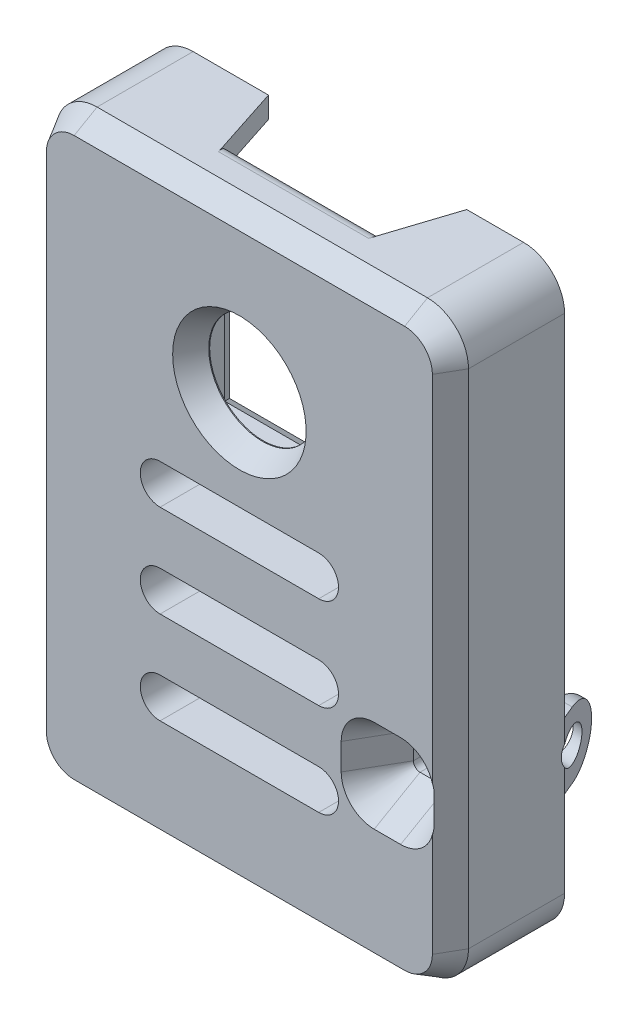
from build123d import *

# Parameters (mm, degrees)
BODY_DEPTH              = 4
SIDEWALLS_DEPTH         = 9
SKETCH2_R               = 4.05
CAMLENS_DEPTH           = 29.509121347
SKETCH3_W               = 8.5
SKETCH3_H               = 8.5
CAMBODY_DEPTH           = 2.2
BOARDSTOPTOP_DEPTH      = 0.4
BOARDSTOPBOTTOM_DEPTH   = 2.2
VENTS_DEPTH             = 28.509452921
FILLET1_START           = -6.2
FILLET1_DEPTH           = 3.2
FILLET1_START_2         = -4.4
FILLET1_2_DEPTH         = 1.4
CHAMFER1_SIZE           = 1
CHAMFER1_SIZE2          = 1.732050808
CHAMFER2_SIZE           = 2
CHAMFER2_SIZE_2         = 3.464101615
CHAMFER3_SIZE           = 0.5
CHAMFER3_SIZE_2         = 0.866025404
CUT_EXTRUDE3_DEPTH      = 47.250621617
FILLET2_R               = 1
ASSYLOCK1_START         = -15.6
ASSYLOCK1_DEPTH         = 1.6
ASSYLOCK2_START         = 14
ASSYLOCK2_DEPTH         = 1.6
CUT_EXTRUDE4_DEPTH      = 30.799664428
CUT_EXTRUDE4_DEPTH_BACK = 30.799664428
SKETCH8_R               = 1.25
CUT_EXTRUDE5_DEPTH      = 30.799664428


with BuildPart() as part:
    # Sketch1 → Body (new body)
    with BuildSketch(Plane.XY):
        with BuildLine():
            Line((-12.5, 20.5), (12.5, 20.5))
            ThreePointArc((12.5, 20.5), (13.560660172, 20.060660172), (14, 19))
            Line((14, 19), (14, -19))
            ThreePointArc((14, -19), (13.560660172, -20.060660172), (12.5, -20.5))
            Line((12.5, -20.5), (-12.5, -20.5))
            ThreePointArc((-12.5, -20.5), (-13.560660172, -20.060660172), (-14, -19))
            Line((-14, -19), (-14, 19))
            ThreePointArc((-14, 19), (-13.560660172, 20.060660172), (-12.5, 20.5))
        make_face()
    extrude(amount=-BODY_DEPTH)

    # Sketch1<2> → SideWalls (add)
    with BuildSketch(Plane.XY):
        with BuildLine():
            Line((12.5, -22.1), (-12.5, -22.1))
            ThreePointArc((-12.5, -22.1), (-14.692031022, -21.192031022), (-15.6, -19))
            Line((-15.6, -19), (-15.6, 19))
            ThreePointArc((-15.6, 19), (-14.692031022, 21.192031022), (-12.5, 22.1))
            Line((-12.5, 22.1), (12.5, 22.1))
            ThreePointArc((12.5, 22.1), (14.692031022, 21.192031022), (15.6, 19))
            Line((15.6, 19), (15.6, -19))
            ThreePointArc((15.6, -19), (14.692031022, -21.192031022), (12.5, -22.1))
        make_face()
        with BuildLine():
            Line((12.5, -20.5), (-12.5, -20.5))
            ThreePointArc((-12.5, -20.5), (-13.560660172, -20.060660172), (-14, -19))
            Line((-14, -19), (-14, 19))
            ThreePointArc((-14, 19), (-13.560660172, 20.060660172), (-12.5, 20.5))
            Line((-12.5, 20.5), (12.5, 20.5))
            ThreePointArc((12.5, 20.5), (13.560660172, 20.060660172), (14, 19))
            Line((14, 19), (14, -19))
            ThreePointArc((14, -19), (13.560660172, -20.060660172), (12.5, -20.5))
        make_face(mode=Mode.SUBTRACT)
    extrude(amount=-SIDEWALLS_DEPTH)

    # Sketch2 → CamLens (cut, through all)
    with BuildSketch(Plane.XY):
        with Locations((0, 10.5)):
            Circle(SKETCH2_R)
        with BuildLine():
            Line((12.2, -8), (10.2, -8))
            ThreePointArc((10.2, -8), (9.846446609, -8.146446609), (9.7, -8.5))
            Line((9.7, -8.5), (9.7, -10.5))
            ThreePointArc((9.7, -10.5), (9.846446609, -10.853553391), (10.2, -11))
            Line((10.2, -11), (12.2, -11))
            ThreePointArc((12.2, -11), (12.553553391, -10.853553391), (12.7, -10.5))
            Line((12.7, -10.5), (12.7, -8.5))
            ThreePointArc((12.7, -8.5), (12.553553391, -8.146446609), (12.2, -8))
        make_face()
    extrude(amount=-CAMLENS_DEPTH, mode=Mode.SUBTRACT)

    # Sketch3 → CamBody (cut)
    with BuildSketch(Plane(origin=(0, 0, -4), x_dir=(-1, 0, 0), z_dir=(0, 0, -1))):
        with Locations((0, 10.5)):
            Rectangle(SKETCH3_W, SKETCH3_H)
    extrude(amount=-CAMBODY_DEPTH, mode=Mode.SUBTRACT)

    # Sketch4 → BoardStopTop (add)
    # profile 1 of 2: a face of its own
    with BuildSketch(Plane(origin=(0, 0, -4), x_dir=(-1, 0, 0), z_dir=(0, 0, -1))):
        with BuildLine():
            Line((-14, 14.75), (-14, 19))
            ThreePointArc((-14, 19), (-13.560660172, 20.060660172), (-12.5, 20.5))
            Line((-12.5, 20.5), (12.5, 20.5))
            ThreePointArc((12.5, 20.5), (13.560660172, 20.060660172), (14, 19))
            Line((14, 19), (14, 14.75))
            Line((14, 14.75), (-14, 14.75))
        make_face()
    # profile 2 of 2: a face of its own
    with BuildSketch(Plane(origin=(0, 0, -4), x_dir=(-1, 0, 0), z_dir=(0, 0, -1))):
        with BuildLine():
            Line((-12.2, -12.3), (-10.2, -12.3))
            ThreePointArc((-10.2, -12.3), (-8.927207794, -11.772792206), (-8.4, -10.5))
            Line((-8.4, -10.5), (-8.4, -8.5))
            ThreePointArc((-8.4, -8.5), (-8.927207794, -7.227207794), (-10.2, -6.7))
            Line((-10.2, -6.7), (-12.2, -6.7))
            ThreePointArc((-12.2, -6.7), (-13.472792206, -7.227207794), (-14, -8.5))
            Line((-14, -8.5), (-14, -10.5))
            ThreePointArc((-14, -10.5), (-13.472792206, -11.772792206), (-12.2, -12.3))
        make_face()
        with BuildLine():
            Line((-12.7, -8.5), (-12.7, -10.5))
            ThreePointArc((-12.7, -10.5), (-12.553553391, -10.853553391), (-12.2, -11))
            Line((-12.2, -11), (-10.2, -11))
            ThreePointArc((-10.2, -11), (-9.846446609, -10.853553391), (-9.7, -10.5))
            Line((-9.7, -10.5), (-9.7, -8.5))
            ThreePointArc((-9.7, -8.5), (-9.846446609, -8.146446609), (-10.2, -8))
            Line((-10.2, -8), (-12.2, -8))
            ThreePointArc((-12.2, -8), (-12.553553391, -8.146446609), (-12.7, -8.5))
        make_face(mode=Mode.SUBTRACT)
    extrude(amount=BOARDSTOPTOP_DEPTH)

    # Sketch5 → BoardStopBottom (add)
    with BuildSketch(Plane(origin=(0, 0, -4), x_dir=(-1, 0, 0), z_dir=(0, 0, -1))):
        with BuildLine():
            Line((12.5, -20.5), (-12.5, -20.5))
            ThreePointArc((-12.5, -20.5), (-13.560660172, -20.060660172), (-14, -19))
            Line((-14, -19), (-14, -16))
            Line((-14, -16), (14, -16))
            Line((14, -16), (14, -19))
            ThreePointArc((14, -19), (13.560660172, -20.060660172), (12.5, -20.5))
        make_face()
    extrude(amount=BOARDSTOPBOTTOM_DEPTH)

    # Sketch10 → Vents (cut, through all)
    with BuildSketch(Plane(origin=(0, 0, -4), x_dir=(-1, 0, 0), z_dir=(0, 0, -1))):
        with BuildLine():
            Line((-6, -4), (6, -4))
            ThreePointArc((6, -4), (7.5, -5.5), (6, -7))
            Line((6, -7), (-6, -7))
            ThreePointArc((-6, -7), (-7.5, -5.5), (-6, -4))
        make_face()
        with BuildLine():
            Line((-6, -11), (6, -11))
            ThreePointArc((6, -11), (7.5, -12.5), (6, -14))
            Line((6, -14), (-6, -14))
            ThreePointArc((-6, -14), (-7.5, -12.5), (-6, -11))
        make_face()
        with BuildLine():
            Line((-6, 3), (6, 3))
            ThreePointArc((6, 3), (7.5, 1.5), (6, 0))
            Line((6, 0), (-6, 0))
            ThreePointArc((-6, 0), (-7.5, 1.5), (-6, 3))
        make_face()
    extrude(amount=-VENTS_DEPTH, mode=Mode.SUBTRACT)

    # Fillet1: read off the stored shape, not the designer's step
    # Fillet1 outline → Fillet1 (add)
    with BuildSketch(Plane.XY.offset(FILLET1_START)):
        with BuildLine():
            Line((-14, -16), (-13, -16))
            ThreePointArc((-13, -16), (-13.707106781, -15.707106781), (-14, -15))
            Line((-14, -15), (-14, -16))
        make_face()
        with BuildLine():
            ThreePointArc((14, -15), (13.707106781, -15.707106781), (13, -16))
            Line((13, -16), (14, -16))
            Line((14, -16), (14, -15))
        make_face()
    extrude(amount=FILLET1_DEPTH)

    # Fillet1 2 outline → Fillet1 2 (add)
    with BuildSketch(Plane.XY.offset(FILLET1_START_2)):
        with BuildLine():
            Line((-14, 14.75), (-14, 13.75))
            ThreePointArc((-14, 13.75), (-13.707106781, 14.457106781), (-13, 14.75))
            Line((-13, 14.75), (-14, 14.75))
        make_face()
        with BuildLine():
            ThreePointArc((12.714285714, -12.224966725), (13.597614305, -12.381497847), (14, -13.183281573))
            Line((14, -13.183281573), (14, -10.5))
            ThreePointArc((14, -10.5), (13.643210706, -11.575705748), (12.714285714, -12.224966725))
        make_face()
        with BuildLine():
            Line((14, 14.75), (13, 14.75))
            ThreePointArc((13, 14.75), (13.707106781, 14.457106781), (14, 13.75))
            Line((14, 13.75), (14, 14.75))
        make_face()
        with BuildLine():
            ThreePointArc((12.714285714, -6.775033275), (13.643210706, -7.424294252), (14, -8.5))
            Line((14, -8.5), (14, -5.816718427))
            ThreePointArc((14, -5.816718427), (13.597614305, -6.618502153), (12.714285714, -6.775033275))
        make_face()
    extrude(amount=FILLET1_2_DEPTH)

    # Chamfer1
    chamfer1_edges = [part.edges().sort_by_distance(p)[0] for p in [
        (14.692031022, 21.192031022, 0),
        (0, 22.1, 0),
        (-14.692031022, 21.192031022, 0),
        (-15.6, 0, 0),
        (-14.692031022, -21.192031022, 0),
        (0, -22.1, 0),
        (14.692031022, -21.192031022, 0),
        (15.6, 0, 0),
        (-4.05, 10.5, 0),
    ]]
    chamfer1_side = [part.faces().sort_by_distance(p)[0] for p in [
        (0, -21.558975047, 0),
    ]]
    chamfer(chamfer1_edges, length=CHAMFER1_SIZE, length2=CHAMFER1_SIZE2, reference=chamfer1_side[0])

    # Chamfer2
    # the kernel refuses this chamfer: 3.464101615, 2 mm, written as the material it takes off along each edge
    with BuildSketch(Plane(origin=(12.2, -10.5, 0), x_dir=(0, -1, 0), z_dir=(-1, 0, 0))) as chamfer2_piece_1:
        Polygon((0.5 + CHAMFER2_SIZE, 0), (0.5, -CHAMFER2_SIZE_2), (0.5, 0), align=None)
    revolve(axis=Axis((12.2, -10.5, 0), (0, 0, 1)), revolution_arc=90, mode=Mode.SUBTRACT)
    with BuildSketch(Plane(origin=(12.7, -10.5, 0), x_dir=(1, 0, 0), z_dir=(0, 1, 0)), Plane(origin=(12.2, -8, 0), x_dir=(0, 1, 0), z_dir=(-1, 0, 0)), Plane(origin=(9.7, -8.5, 0), x_dir=(-1, 0, 0), z_dir=(0, -1, 0)), Plane(origin=(10.2, -11, 0), x_dir=(0, -1, 0), z_dir=(1, 0, 0))) as chamfer2_piece_2:
        Polygon((CHAMFER2_SIZE, 0), (0, CHAMFER2_SIZE_2), (0, 0), align=None)
    extrude(amount=2, mode=Mode.SUBTRACT)
    with BuildSketch(Plane(origin=(12.2, -8.5, 0), x_dir=(1, 0, 0), z_dir=(0, -1, 0))) as chamfer2_piece_3:
        Polygon((0.5 + CHAMFER2_SIZE, 0), (0.5, -CHAMFER2_SIZE_2), (0.5, 0), align=None)
    revolve(axis=Axis((12.2, -8.5, 0), (0, 0, 1)), revolution_arc=90, mode=Mode.SUBTRACT)
    with BuildSketch(Plane(origin=(10.2, -8.5, 0), x_dir=(0, 1, 0), z_dir=(1, 0, 0))) as chamfer2_piece_4:
        Polygon((0.5 + CHAMFER2_SIZE, 0), (0.5, -CHAMFER2_SIZE_2), (0.5, 0), align=None)
    revolve(axis=Axis((10.2, -8.5, 0), (0, 0, 1)), revolution_arc=90, mode=Mode.SUBTRACT)
    with BuildSketch(Plane(origin=(10.2, -10.5, 0), x_dir=(-1, 0, 0), z_dir=(0, 1, 0))) as chamfer2_piece_5:
        Polygon((0.5 + CHAMFER2_SIZE, 0), (0.5, -CHAMFER2_SIZE_2), (0.5, 0), align=None)
    revolve(axis=Axis((10.2, -10.5, 0), (0, 0, 1)), revolution_arc=90, mode=Mode.SUBTRACT)

    # Chamfer3
    # the kernel refuses this chamfer: 0.866025404, 0.5 mm, written as the material it takes off along each edge
    with BuildSketch(Plane(origin=(-4.25, 14.75, -4), x_dir=(-1, 0, 0), z_dir=(0, -1, 0)), Plane(origin=(4.25, 6.25, -4), x_dir=(1, 0, 0), z_dir=(0, 1, 0)), Plane(origin=(-4.25, 6.25, -4), x_dir=(0, -1, 0), z_dir=(1, 0, 0))) as chamfer3_piece_1:
        Polygon((CHAMFER3_SIZE, 0), (0, -CHAMFER3_SIZE_2), (0, 0), align=None)
    extrude(amount=8.5, mode=Mode.SUBTRACT)
    with BuildSketch(Plane(origin=(6, 1.5, -4), x_dir=(0, -1, 0), z_dir=(-1, 0, 0))) as chamfer3_piece_2:
        Polygon((1.5, CHAMFER3_SIZE_2), (1.5 + CHAMFER3_SIZE, 0), (1.5, 0), align=None)
    revolve(axis=Axis((6, 1.5, -4), (0, 0, 1)), revolution_arc=180, mode=Mode.SUBTRACT)
    with BuildSketch(Plane(origin=(-6, 0, -4), x_dir=(0, 0, 1), z_dir=(1, 0, 0)), Plane(origin=(6, 3, -4), x_dir=(0, 0, 1), z_dir=(-1, 0, 0)), Plane(origin=(-6, -14, -4), x_dir=(0, 0, 1), z_dir=(1, 0, 0)), Plane(origin=(6, -11, -4), x_dir=(0, 0, 1), z_dir=(-1, 0, 0)), Plane(origin=(-6, -7, -4), x_dir=(0, 0, 1), z_dir=(1, 0, 0)), Plane(origin=(6, -4, -4), x_dir=(0, 0, 1), z_dir=(-1, 0, 0))) as chamfer3_piece_3:
        Polygon((CHAMFER3_SIZE_2, 0), (0, CHAMFER3_SIZE), (0, 0), align=None)
    extrude(amount=12, mode=Mode.SUBTRACT)
    with BuildSketch(Plane(origin=(-6, 1.5, -4), x_dir=(0, 1, 0), z_dir=(1, 0, 0))) as chamfer3_piece_4:
        Polygon((1.5, CHAMFER3_SIZE_2), (1.5 + CHAMFER3_SIZE, 0), (1.5, 0), align=None)
    revolve(axis=Axis((-6, 1.5, -4), (0, 0, 1)), revolution_arc=180, mode=Mode.SUBTRACT)
    with BuildSketch(Plane(origin=(6, -12.5, -4), x_dir=(0, -1, 0), z_dir=(-1, 0, 0))) as chamfer3_piece_5:
        Polygon((1.5, CHAMFER3_SIZE_2), (1.5 + CHAMFER3_SIZE, 0), (1.5, 0), align=None)
    revolve(axis=Axis((6, -12.5, -4), (0, 0, 1)), revolution_arc=180, mode=Mode.SUBTRACT)
    with BuildSketch(Plane(origin=(-6, -12.5, -4), x_dir=(0, 1, 0), z_dir=(1, 0, 0))) as chamfer3_piece_6:
        Polygon((1.5, CHAMFER3_SIZE_2), (1.5 + CHAMFER3_SIZE, 0), (1.5, 0), align=None)
    revolve(axis=Axis((-6, -12.5, -4), (0, 0, 1)), revolution_arc=180, mode=Mode.SUBTRACT)
    with BuildSketch(Plane(origin=(6, -5.5, -4), x_dir=(0, -1, 0), z_dir=(-1, 0, 0))) as chamfer3_piece_7:
        Polygon((1.5, CHAMFER3_SIZE_2), (1.5 + CHAMFER3_SIZE, 0), (1.5, 0), align=None)
    revolve(axis=Axis((6, -5.5, -4), (0, 0, 1)), revolution_arc=180, mode=Mode.SUBTRACT)
    with BuildSketch(Plane(origin=(-6, -5.5, -4), x_dir=(0, 1, 0), z_dir=(1, 0, 0))) as chamfer3_piece_8:
        Polygon((1.5, CHAMFER3_SIZE_2), (1.5 + CHAMFER3_SIZE, 0), (1.5, 0), align=None)
    revolve(axis=Axis((-6, -5.5, -4), (0, 0, 1)), revolution_arc=180, mode=Mode.SUBTRACT)
    with BuildSketch(Plane(origin=(13, -16, -6.2), x_dir=(0, 0, 1), z_dir=(-1, 0, 0))) as chamfer3_piece_9:
        Polygon((CHAMFER3_SIZE, 0), (0, -CHAMFER3_SIZE_2), (0, 0), align=None)
    extrude(amount=26, mode=Mode.SUBTRACT)
    with BuildSketch(Plane(origin=(-12.999999999, -14.999999999, -6.2), x_dir=(-6.36912744361302e-10, -1.0, 0), z_dir=(1.0, -6.36912744361302e-10, 0))) as chamfer3_piece_10_section:
        Polygon((1.000000001, -CHAMFER3_SIZE), (1.000000001 + CHAMFER3_SIZE_2, 0), (1.000000001, 0), align=None)
    chamfer3_piece_10 = revolve(axis=Axis((-12.999999999, -14.999999999, -6.2), (0, 0, -1)), revolution_arc=218.421729018, mode=Mode.PRIVATE)
    chamfer3_piece_10 = split(chamfer3_piece_10, bisect_by=Plane(origin=(-14, -14.999999999, -6.2), z_dir=(1, 0, 0)), keep=Keep.TOP, mode=Mode.PRIVATE)
    add(chamfer3_piece_10, mode=Mode.SUBTRACT)
    with BuildSketch(Plane(origin=(12.999999999, -14.999999999, -6.2), x_dir=(-0.621444946291684, 0.7834578346845006, 0), z_dir=(-0.7834578346845006, -0.621444946291684, 0))) as chamfer3_piece_11_section:
        Polygon((1.000000001, -CHAMFER3_SIZE), (1.000000001 + CHAMFER3_SIZE_2, 0), (1.000000001, 0), align=None)
    chamfer3_piece_11 = revolve(axis=Axis((12.999999999, -14.999999999, -6.2), (0, 0, -1)), revolution_arc=218.421729018, mode=Mode.PRIVATE)
    chamfer3_piece_11 = split(chamfer3_piece_11, bisect_by=Plane(origin=(14, -14.999999999, -6.2), z_dir=(-1, 0, 0)), keep=Keep.TOP, mode=Mode.PRIVATE)
    add(chamfer3_piece_11, mode=Mode.SUBTRACT)
    with BuildSketch(Plane(origin=(-6.490481985, 6.25, -4), x_dir=(0, -1, 0), z_dir=(1, 0, 0))) as chamfer3_piece_12a_section:
        Polygon((CHAMFER3_SIZE, 0), (0, -CHAMFER3_SIZE_2), (0, 0), align=None)
    chamfer3_piece_12a = extrude(amount=10.740481985, mode=Mode.PRIVATE)
    chamfer3_piece_12a = split(chamfer3_piece_12a, bisect_by=Plane(origin=(-4.25, 6.25, -4), z_dir=(-1, 0, 0)), keep=Keep.TOP, mode=Mode.PRIVATE)
    with BuildSketch(Plane(origin=(-4.25, 14.75, -4), x_dir=(-1, 0, 0), z_dir=(0, -1, 0))) as chamfer3_piece_12b_section:
        Polygon((CHAMFER3_SIZE, 0), (0, -CHAMFER3_SIZE_2), (0, 0), align=None)
    chamfer3_piece_12b = extrude(amount=10.740481985, mode=Mode.PRIVATE)
    chamfer3_piece_12b = split(chamfer3_piece_12b, bisect_by=Plane(origin=(-4.25, 6.25, -4), z_dir=(0, -1, 0)), keep=Keep.TOP, mode=Mode.PRIVATE)
    chamfer3_piece_12 = chamfer3_piece_12a & chamfer3_piece_12b
    add(chamfer3_piece_12, mode=Mode.SUBTRACT)
    with BuildSketch(Plane(origin=(4.25, 4.009518015, -4), x_dir=(1, 0, 0), z_dir=(0, 1, 0))) as chamfer3_piece_13a_section:
        Polygon((CHAMFER3_SIZE, 0), (0, -CHAMFER3_SIZE_2), (0, 0), align=None)
    chamfer3_piece_13a = extrude(amount=10.740481985, mode=Mode.PRIVATE)
    chamfer3_piece_13a = split(chamfer3_piece_13a, bisect_by=Plane(origin=(4.25, 6.25, -4), z_dir=(0, -1, 0)), keep=Keep.TOP, mode=Mode.PRIVATE)
    with BuildSketch(Plane(origin=(-4.25, 6.25, -4), x_dir=(0, -1, 0), z_dir=(1, 0, 0))) as chamfer3_piece_13b_section:
        Polygon((CHAMFER3_SIZE, 0), (0, -CHAMFER3_SIZE_2), (0, 0), align=None)
    chamfer3_piece_13b = extrude(amount=10.740481985, mode=Mode.PRIVATE)
    chamfer3_piece_13b = split(chamfer3_piece_13b, bisect_by=Plane(origin=(4.25, 6.25, -4), z_dir=(1, 0, 0)), keep=Keep.TOP, mode=Mode.PRIVATE)
    chamfer3_piece_13 = chamfer3_piece_13a & chamfer3_piece_13b
    add(chamfer3_piece_13, mode=Mode.SUBTRACT)

    # Sketch6 → Cut-Extrude3 (cut, through all)
    with BuildSketch(Plane.XZ.offset(-20.5)):
        Polygon((6.705369397, -4.4), (-5.305369397, -4.4), (-6.8, -9), (8.2, -9), align=None)
    extrude(amount=-CUT_EXTRUDE3_DEPTH, mode=Mode.SUBTRACT)

    # Fillet2
    fillet2_edges = [part.edges().sort_by_distance(p)[0] for p in [
        (0.7, 22.1, -4.4),
    ]]
    fillet(fillet2_edges, radius=FILLET2_R)

    # Sketch7 → AssyLock1 (add)
    with BuildSketch(Plane(origin=(0, 0, 0), x_dir=(0, 0, -1), z_dir=(1, 0, 0)).offset(ASSYLOCK1_START)):
        with BuildLine():
            Line((10, -12.5), (9, -12.5))
            ThreePointArc((9, -12.5), (6.5, -10), (9, -7.5))
            Line((9, -7.5), (10, -7.5))
            ThreePointArc((10, -7.5), (12.5, -10), (10, -12.5))
        make_face()
    extrude(amount=ASSYLOCK1_DEPTH)

    # Sketch7<2> → AssyLock2 (add)
    with BuildSketch(Plane(origin=(0, 0, 0), x_dir=(0, 0, -1), z_dir=(1, 0, 0)).offset(ASSYLOCK2_START)):
        with BuildLine():
            Line((10, -12.5), (9, -12.5))
            ThreePointArc((9, -12.5), (6.5, -10), (9, -7.5))
            Line((9, -7.5), (10, -7.5))
            ThreePointArc((10, -7.5), (12.5, -10), (10, -12.5))
        make_face()
    extrude(amount=ASSYLOCK2_DEPTH)

    # Sketch8 → Cut-Extrude4 (cut, two sides: drawn at the far end of the back side and taken through both)
    with BuildSketch(Plane(origin=(0, 0, 0), x_dir=(0, 0, -1), z_dir=(1, 0, 0)).offset(-CUT_EXTRUDE4_DEPTH_BACK)):
        with Locations((10, -10)):
            Circle(SKETCH8_R)
    extrude(amount=CUT_EXTRUDE4_DEPTH + CUT_EXTRUDE4_DEPTH_BACK, mode=Mode.SUBTRACT)

    # Sketch9 → Cut-Extrude5 (cut, through all)
    with BuildSketch(Plane(origin=(0, 0, 0), x_dir=(1, 0, 0), z_dir=(0, 1, 0))):
        Polygon((15.6, 9), (14.145115901, 12.5), (15.6, 12.5), align=None)
        Polygon((-15.6, 9), (-14.32610418, 12.5), (-15.6, 12.5), align=None)
    extrude(amount=-CUT_EXTRUDE5_DEPTH, mode=Mode.SUBTRACT)


solid = part.part
